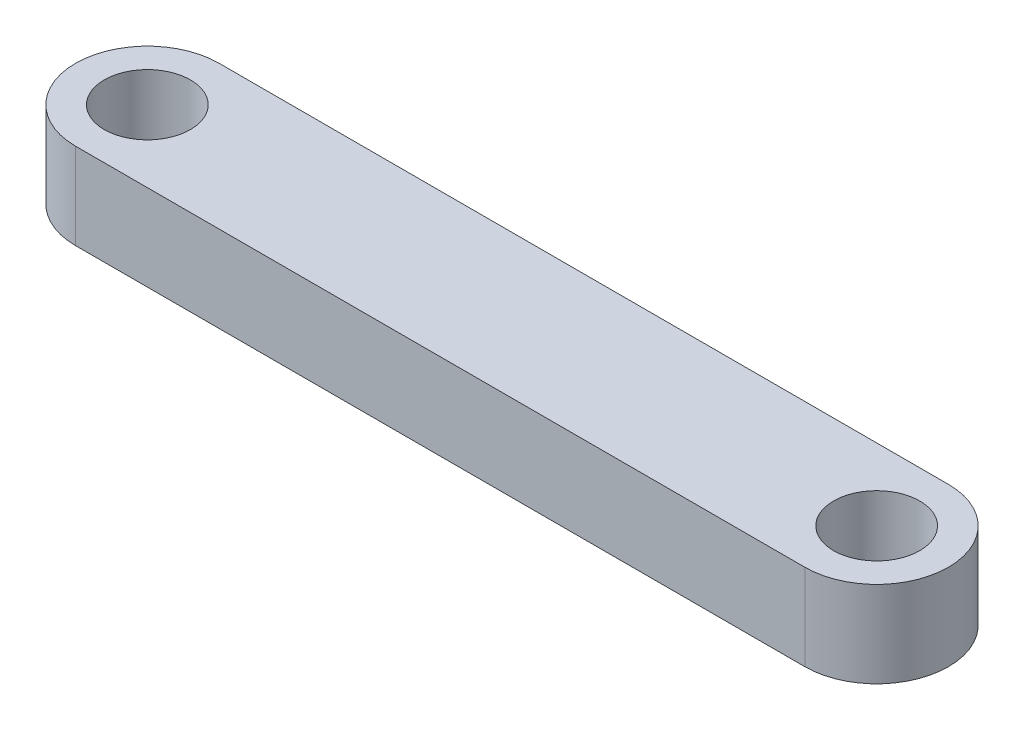
from build123d import *

# Parameters (mm, degrees)
SKETCH1_R           = 1.5
BOSS_EXTRUDE2_DEPTH = 1.5


with BuildPart() as part:
    # Sketch1 → Boss-Extrude2 (new, symmetric)
    with BuildSketch(Plane(origin=(0, 0, 0), x_dir=(1, 0, 0), z_dir=(0, 1, 0))):
        with BuildLine():
            Line((-12.7, 2.5), (12.7, 2.5))
            ThreePointArc((12.7, 2.5), (15.2, 0), (12.7, -2.5))
            Line((12.7, -2.5), (-12.7, -2.5))
            ThreePointArc((-12.7, -2.5), (-15.2, 0), (-12.7, 2.5))
        make_face()
        with Locations((-12.7, 0)):
            Circle(SKETCH1_R, mode=Mode.SUBTRACT)
        with Locations((12.7, 0)):
            Circle(SKETCH1_R, mode=Mode.SUBTRACT)
    extrude(amount=BOSS_EXTRUDE2_DEPTH, both=True)


solid = part.part
